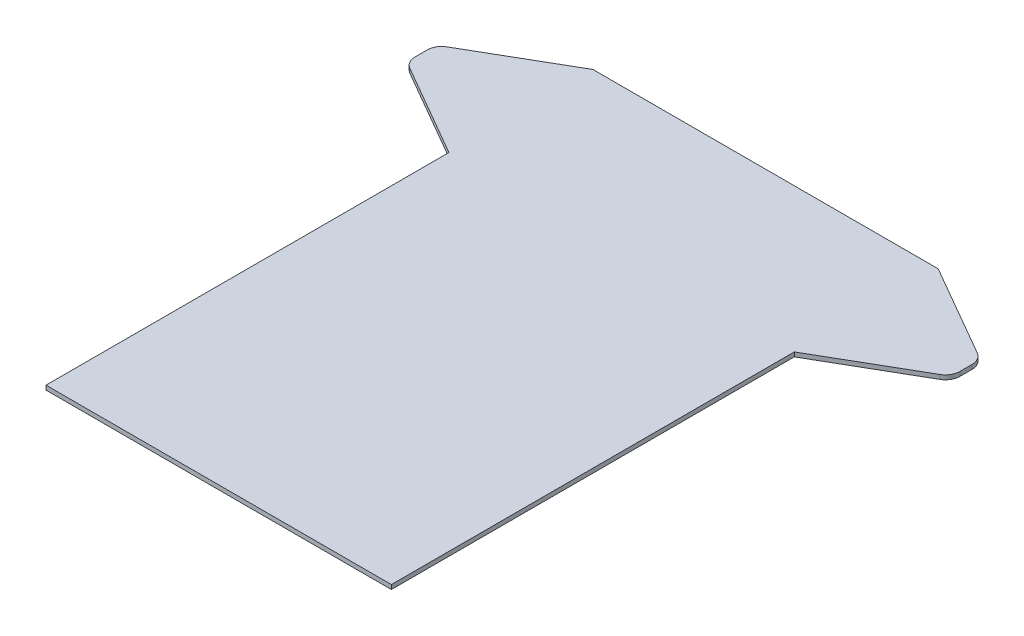
from build123d import *

# Parameters (mm, degrees)
BOSS_EXTRUDE2_DEPTH = 1.905
FILLET1_R           = 6.35


with BuildPart() as part:
    # Sketch3 → Boss-Extrude2 (new body)
    with BuildSketch(Plane(origin=(0, 0, 0), x_dir=(1, 0, 0), z_dir=(0, 1, 0))):
        Polygon((165.1, 215.9), (12.7, 215.9), (-31.294090512, 190.5), (-31.294090512, 177.8), (12.7, 152.4), (12.7, -25.4), (165.1, -25.4), (165.1, 152.4), (209.094090512, 177.8), (209.094090512, 190.5), align=None)
    extrude(amount=BOSS_EXTRUDE2_DEPTH)

    # Fillet1
    fillet1_edges = [part.edges().sort_by_distance(p)[0] for p in [
        (209.094090512, 0.9525, -177.8),
        (209.094090512, 0.9525, -190.5),
        (-31.294090512, 0.9525, -190.5),
        (-31.294090512, 0.9525, -177.8),
    ]]
    fillet(fillet1_edges, radius=FILLET1_R)


solid = part.part
